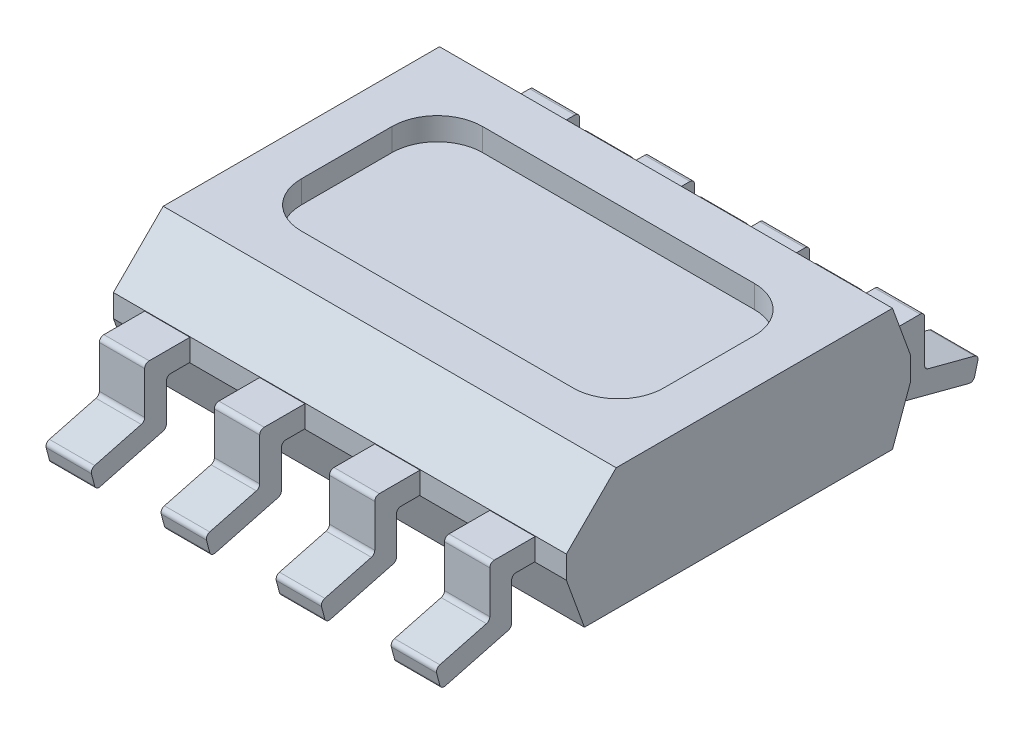
from build123d import *

# Parameters (mm, degrees)
SKETCH1_W            = 5
SKETCH1_H            = 3.8
BOSS_EXTRUDE1_DEPTH  = 1.35
CUT_EXTRUDE1_DEPTH   = 5
CUT_EXTRUDE2_DEPTH   = 0.25
BOSS_EXTRUDE2_DEPTH  = 0.25
LPATTERN1_COUNT      = 4
LPATTERN1_PITCH      = 1.27
MIRROR1_COPY_1_DEPTH = 0.25
MIRROR1_COPY_2_DEPTH = 0.25
MIRROR1_COPY_3_DEPTH = 0.25


with BuildPart() as part:
    # Sketch1 → Boss-Extrude1 (new body)
    with BuildSketch(Plane(origin=(0, 0, 0), x_dir=(1, 0, 0), z_dir=(0, 1, 0))):
        with Locations((2.5, 1.9)):
            Rectangle(SKETCH1_W, SKETCH1_H)
    extrude(amount=BOSS_EXTRUDE1_DEPTH)

    # Sketch2 → Cut-Extrude1 (cut)
    with BuildSketch(Plane(origin=(5, 0, 0), x_dir=(0, 0, -1), z_dir=(1, 0, 0))):
        Polygon((0, 0.8), (0.55, 1.35), (0, 1.35), align=None)
        Polygon((3.8, 1.35), (3.6, 1.35), (3.8, 0.8), align=None)
        Polygon((0.2, 0), (0, 0.55), (0, 0), align=None)
        Polygon((3.8, 0), (3.8, 0.55), (3.6, 0), align=None)
    extrude(amount=-CUT_EXTRUDE1_DEPTH, mode=Mode.SUBTRACT)

    # Sketch3 → Cut-Extrude2 (cut)
    with BuildSketch(Plane(origin=(0, 1.35, 0), x_dir=(1, 0, 0), z_dir=(0, 1, 0))):
        with BuildLine():
            Line((1, 3.075), (4, 3.075))
            ThreePointArc((4, 3.075), (4.353553391, 2.928553391), (4.5, 2.575))
            Line((4.5, 2.575), (4.5, 1.575))
            ThreePointArc((4.5, 1.575), (4.353553391, 1.221446609), (4, 1.075))
            Line((4, 1.075), (1, 1.075))
            ThreePointArc((1, 1.075), (0.646446609, 1.221446609), (0.5, 1.575))
            Line((0.5, 1.575), (0.5, 2.575))
            ThreePointArc((0.5, 2.575), (0.646446609, 2.928553391), (1, 3.075))
        make_face()
    extrude(amount=-CUT_EXTRUDE2_DEPTH, mode=Mode.SUBTRACT)

    # Sketch4 → Boss-Extrude2 (add, symmetric)
    with BuildSketch(Plane(origin=(4.405, 0, 0), x_dir=(0, 0, -1), z_dir=(1, 0, 0))):
        with BuildLine():
            Line((3.8, 0.795), (4.25, 0.795))
            ThreePointArc((4.25, 0.795), (4.285355339, 0.780355339), (4.3, 0.745))
            Line((4.3, 0.745), (4.3, 0.278551504))
            ThreePointArc((4.3, 0.278551504), (4.31040014, 0.248025269), (4.337274043, 0.230198118))
            Line((4.337274043, 0.230198118), (4.851646613, 0.094822214))
            ThreePointArc((4.851646613, 0.094822214), (4.882110274, 0.071661224), (4.887274043, 0.03374287))
            Line((4.887274043, 0.03374287), (4.851641362, -0.101646613))
            ThreePointArc((4.851641362, -0.101646613), (4.828480372, -0.132110274), (4.790562018, -0.137274043))
            Line((4.790562018, -0.137274043), (4.097274043, 0.045189976))
            ThreePointArc((4.097274043, 0.045189976), (4.07040014, 0.063017127), (4.06, 0.093543363))
            Line((4.06, 0.093543363), (4.06, 0.505))
            ThreePointArc((4.06, 0.505), (4.045355339, 0.540355339), (4.01, 0.555))
            Line((4.01, 0.555), (3.8, 0.555))
            Line((3.8, 0.555), (3.8, 0.795))
        make_face()
    boss_extrude2 = extrude(amount=BOSS_EXTRUDE2_DEPTH, both=True)

    # LPattern1: Boss-Extrude2 ×4
    with Locations(*[(-i * LPATTERN1_PITCH, 0, 0) for i in range(1, LPATTERN1_COUNT)]):
        add(boss_extrude2)

    # Mirror1: Boss-Extrude2 across plane
    add(boss_extrude2.mirror(Plane(origin=(0, 0, -1.9), x_dir=(1, 0, 0), z_dir=(0, 0, -1))))

    # Mirror1 copy 1 sketch → Mirror1 copy 1 (add, symmetric)
    with BuildSketch(Plane(origin=(3.135, 0, -3.8), x_dir=(0, 0, 1), z_dir=(1, 0, 0))):
        with BuildLine():
            Line((3.8, -0.795), (4.25, -0.795))
            ThreePointArc((4.25, -0.795), (4.285355339, -0.780355339), (4.3, -0.745))
            Line((4.3, -0.745), (4.3, -0.278551504))
            ThreePointArc((4.3, -0.278551504), (4.31040014, -0.248025269), (4.337274043, -0.230198118))
            Line((4.337274043, -0.230198118), (4.851646613, -0.094822214))
            ThreePointArc((4.851646613, -0.094822214), (4.882110274, -0.071661224), (4.887274043, -0.03374287))
            Line((4.887274043, -0.03374287), (4.851641362, 0.101646613))
            ThreePointArc((4.851641362, 0.101646613), (4.828480372, 0.132110274), (4.790562018, 0.137274043))
            Line((4.790562018, 0.137274043), (4.097274043, -0.045189976))
            ThreePointArc((4.097274043, -0.045189976), (4.07040014, -0.063017127), (4.06, -0.093543363))
            Line((4.06, -0.093543363), (4.06, -0.505))
            ThreePointArc((4.06, -0.505), (4.045355339, -0.540355339), (4.01, -0.555))
            Line((4.01, -0.555), (3.8, -0.555))
            Line((3.8, -0.555), (3.8, -0.795))
        make_face()
    extrude(amount=MIRROR1_COPY_1_DEPTH, both=True)

    # Mirror1 copy 2 sketch → Mirror1 copy 2 (add, symmetric)
    with BuildSketch(Plane(origin=(1.865, 0, -3.8), x_dir=(0, 0, 1), z_dir=(1, 0, 0))):
        with BuildLine():
            Line((3.8, -0.795), (4.25, -0.795))
            ThreePointArc((4.25, -0.795), (4.285355339, -0.780355339), (4.3, -0.745))
            Line((4.3, -0.745), (4.3, -0.278551504))
            ThreePointArc((4.3, -0.278551504), (4.31040014, -0.248025269), (4.337274043, -0.230198118))
            Line((4.337274043, -0.230198118), (4.851646613, -0.094822214))
            ThreePointArc((4.851646613, -0.094822214), (4.882110274, -0.071661224), (4.887274043, -0.03374287))
            Line((4.887274043, -0.03374287), (4.851641362, 0.101646613))
            ThreePointArc((4.851641362, 0.101646613), (4.828480372, 0.132110274), (4.790562018, 0.137274043))
            Line((4.790562018, 0.137274043), (4.097274043, -0.045189976))
            ThreePointArc((4.097274043, -0.045189976), (4.07040014, -0.063017127), (4.06, -0.093543363))
            Line((4.06, -0.093543363), (4.06, -0.505))
            ThreePointArc((4.06, -0.505), (4.045355339, -0.540355339), (4.01, -0.555))
            Line((4.01, -0.555), (3.8, -0.555))
            Line((3.8, -0.555), (3.8, -0.795))
        make_face()
    extrude(amount=MIRROR1_COPY_2_DEPTH, both=True)

    # Mirror1 copy 3 sketch → Mirror1 copy 3 (add, symmetric)
    with BuildSketch(Plane(origin=(0.595, 0, -3.8), x_dir=(0, 0, 1), z_dir=(1, 0, 0))):
        with BuildLine():
            Line((3.8, -0.795), (4.25, -0.795))
            ThreePointArc((4.25, -0.795), (4.285355339, -0.780355339), (4.3, -0.745))
            Line((4.3, -0.745), (4.3, -0.278551504))
            ThreePointArc((4.3, -0.278551504), (4.31040014, -0.248025269), (4.337274043, -0.230198118))
            Line((4.337274043, -0.230198118), (4.851646613, -0.094822214))
            ThreePointArc((4.851646613, -0.094822214), (4.882110274, -0.071661224), (4.887274043, -0.03374287))
            Line((4.887274043, -0.03374287), (4.851641362, 0.101646613))
            ThreePointArc((4.851641362, 0.101646613), (4.828480372, 0.132110274), (4.790562018, 0.137274043))
            Line((4.790562018, 0.137274043), (4.097274043, -0.045189976))
            ThreePointArc((4.097274043, -0.045189976), (4.07040014, -0.063017127), (4.06, -0.093543363))
            Line((4.06, -0.093543363), (4.06, -0.505))
            ThreePointArc((4.06, -0.505), (4.045355339, -0.540355339), (4.01, -0.555))
            Line((4.01, -0.555), (3.8, -0.555))
            Line((3.8, -0.555), (3.8, -0.795))
        make_face()
    extrude(amount=MIRROR1_COPY_3_DEPTH, both=True)


solid = part.part
